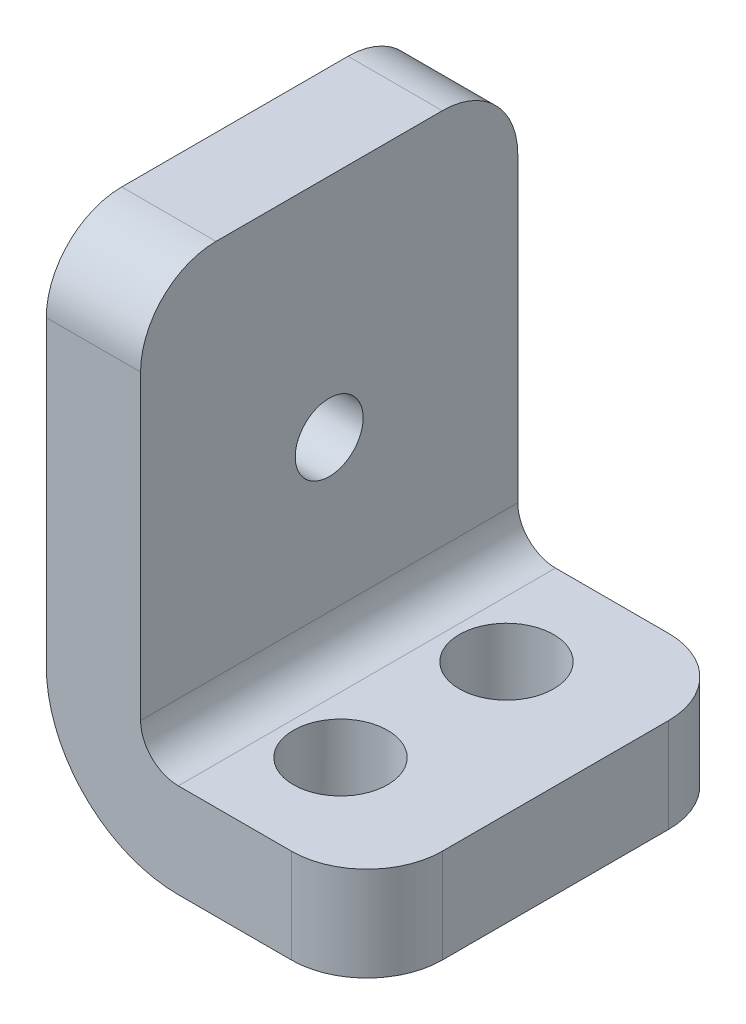
from build123d import *

# Parameters (mm, degrees)
BOSS_EXTRUDE1_DEPTH = 12.7
FILLET1_R           = 2.54
CUT_EXTRUDE1_REACH  = 31.654
SKETCH2_R           = 1.143
CUT_EXTRUDE2_REACH  = 22.36
SKETCH3_R           = 1.5875


with BuildPart() as part:
    # Sketch1 → Boss-Extrude1 (new body)
    with BuildSketch(Plane.XY):
        with BuildLine():
            Line((0, 25.690786623), (0, 12.990786623))
            ThreePointArc((0, 12.990786623), (0.371974388, 12.092761011), (1.27, 11.720786623))
            Line((1.27, 11.720786623), (7.62, 11.720786623))
            Line((7.62, 11.720786623), (7.62, 8.545786623))
            Line((7.62, 8.545786623), (1.27, 8.545786623))
            ThreePointArc((1.27, 8.545786623), (-1.873089642, 9.847696981), (-3.175, 12.990786623))
            Line((-3.175, 12.990786623), (-3.175, 25.690786623))
            Line((-3.175, 25.690786623), (0, 25.690786623))
        make_face()
    extrude(amount=BOSS_EXTRUDE1_DEPTH)

    # Fillet1
    fillet1_edges = [part.edges().sort_by_distance(p)[0] for p in [
        (7.62, 10.133286623, 12.7),
        (7.62, 10.133286623, 0),
        (-1.5875, 25.690786623, 12.7),
        (-1.5875, 25.690786623, 0),
    ]]
    fillet(fillet1_edges, radius=FILLET1_R)

    # Sketch2 → Cut-Extrude1 (cut, up to next)
    with BuildSketch(Plane(origin=(0, 0, 0), x_dir=(0, 0, -1), z_dir=(1, 0, 0)), mode=Mode.PRIVATE) as cut_extrude1_sk1:
        with Locations((-6.35, 18.070786623)):
            Circle(SKETCH2_R)
    cut_extrude1_tool1 = extrude(cut_extrude1_sk1.sketch, amount=-CUT_EXTRUDE1_REACH, mode=Mode.PRIVATE) & part.part
    add(cut_extrude1_tool1.solids().sort_by_distance((0, 18.070787, 6.35))[0], mode=Mode.SUBTRACT)

    # Sketch3 → Cut-Extrude2 (cut, up to next)
    with BuildSketch(Plane(origin=(0, 11.720786623, 0), x_dir=(1, 0, 0), z_dir=(0, 1, 0)), mode=Mode.PRIVATE) as cut_extrude2_sk1:
        with Locations((3.175, -9.144)):
            Circle(SKETCH3_R)
    cut_extrude2_tool1 = extrude(cut_extrude2_sk1.sketch, amount=-CUT_EXTRUDE2_REACH, mode=Mode.PRIVATE) & part.part
    # Sketch3 → Cut-Extrude2 (cut, up to next)
    with BuildSketch(Plane(origin=(0, 11.720786623, 0), x_dir=(1, 0, 0), z_dir=(0, 1, 0)), mode=Mode.PRIVATE) as cut_extrude2_sk2:
        with Locations((3.175, -3.556)):
            Circle(SKETCH3_R)
    cut_extrude2_tool2 = extrude(cut_extrude2_sk2.sketch, amount=-CUT_EXTRUDE2_REACH, mode=Mode.PRIVATE) & part.part
    add(cut_extrude2_tool1.solids().sort_by_distance((3.175, 11.720787, 9.144))[0], mode=Mode.SUBTRACT)
    add(cut_extrude2_tool2.solids().sort_by_distance((3.175, 11.720787, 3.556))[0], mode=Mode.SUBTRACT)


solid = part.part
